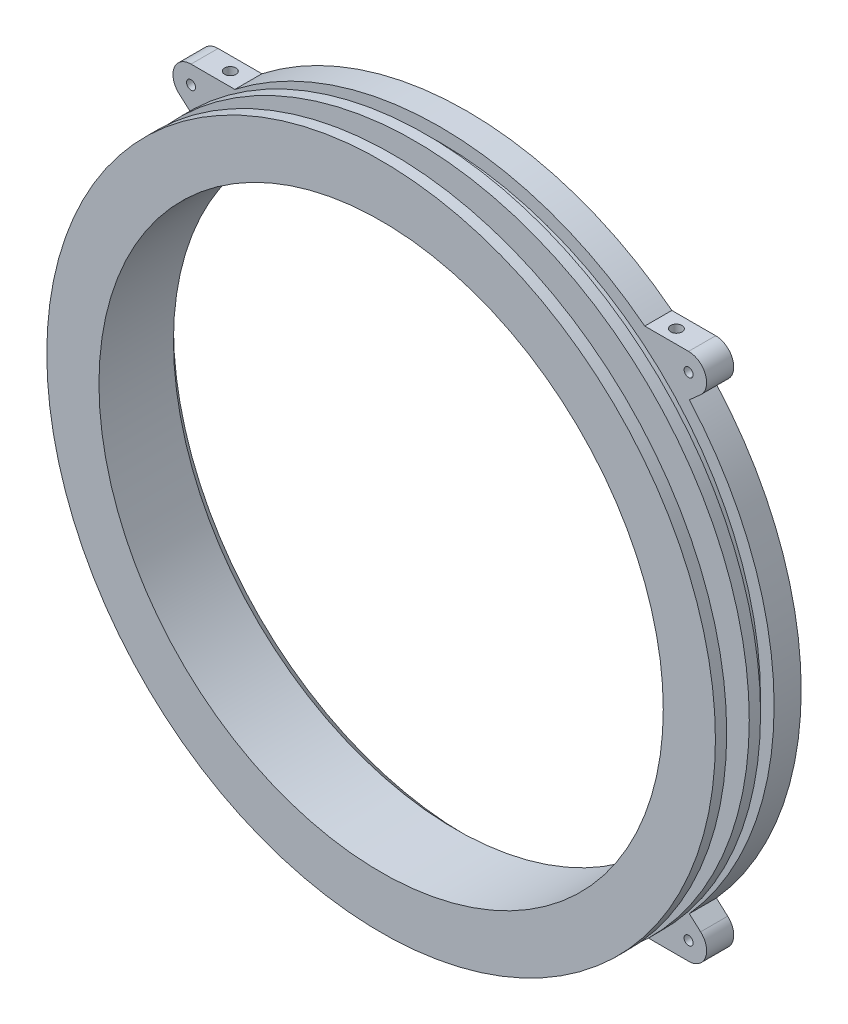
from build123d import *

# Parameters (mm, degrees)
SKETCH_1_R               = 148.1
SKETCH_1_R_2             = 125
EXTRUDE_1_DEPTH          = 12
SKETCH_2_R               = 142.1
SKETCH_2_R_2             = 125
EXTRUDE_2_DEPTH          = 6
SKETCH_3_R               = 148.1
SKETCH_3_R_2             = 125
EXTRUDE_3_DEPTH          = 5
SKETCH_4_R               = 133.1
SKETCH_4_R_2             = 125
EXTRUDE_4_DEPTH          = 10
SKETCH_5_R               = 148.1
SKETCH_5_R_2             = 125
EXTRUDE_5_DEPTH          = 5
SKETCH_6_R               = 2
EXTRUDE_6_DEPTH          = 12
SKETCH_7_R               = 2.5
CUT_EXTRUDE_1_DEPTH      = 15
MIRROR_2_COPY_1_SKETCH_R = 2.5
MIRROR_2_COPY_1_DEPTH    = 15
MIRROR_2_COPY_2_SKETCH_R = 2.5
MIRROR_2_COPY_2_DEPTH    = 15
CHAMFER_1_SIZE           = 5


with BuildPart() as part:
    # 草图1 → 凸台-拉伸1 (new body)
    with BuildSketch(Plane.XY):
        Circle(SKETCH_1_R)
        Circle(SKETCH_1_R_2, mode=Mode.SUBTRACT)
    extrude(amount=EXTRUDE_1_DEPTH)

    # 草图2 → 凸台-拉伸2 (add)
    with BuildSketch(Plane.XY.offset(12)):
        Circle(SKETCH_2_R)
        Circle(SKETCH_2_R_2, mode=Mode.SUBTRACT)
    extrude(amount=EXTRUDE_2_DEPTH)

    # 草图3 → 凸台-拉伸3 (add)
    with BuildSketch(Plane.XY.offset(18)):
        Circle(SKETCH_3_R)
        Circle(SKETCH_3_R_2, mode=Mode.SUBTRACT)
    extrude(amount=EXTRUDE_3_DEPTH)

    # 草图4 → 凸台-拉伸4 (add)
    with BuildSketch(Plane.XY.offset(23)):
        Circle(SKETCH_4_R)
        Circle(SKETCH_4_R_2, mode=Mode.SUBTRACT)
    extrude(amount=EXTRUDE_4_DEPTH)

    # 草图5 → 凸台-拉伸5 (add)
    with BuildSketch(Plane.XY.offset(33)):
        Circle(SKETCH_5_R)
        Circle(SKETCH_5_R_2, mode=Mode.SUBTRACT)
    extrude(amount=EXTRUDE_5_DEPTH)

    # 草图6 → 凸台-拉伸6 (add)
    # profile 1 of 4: a face of its own
    with BuildSketch(Plane.XY):
        with BuildLine():
            Line((-90.799834802, 117), (-110.208193805, 117))
            ThreePointArc((-110.208193805, 117), (-117.683675787, 111.849064607), (-115.532726589, 103.029292284))
            Line((-115.532726589, 103.029292284), (-110.532726589, 98.570413171))
            ThreePointArc((-110.532726589, 98.570413171), (-101.087152926, 108.235842092), (-90.799834802, 117))
        make_face()
        with Locations((-110.208193805, 109)):
            Circle(SKETCH_6_R, mode=Mode.SUBTRACT)
    # profile 2 of 4: a face of its own
    with BuildSketch(Plane.XY):
        with BuildLine():
            Line((115.532726589, 103.029292284), (110.532726589, 98.570413171))
            ThreePointArc((110.532726589, 98.570413171), (101.087152926, 108.235842092), (90.799834802, 117))
            Line((90.799834802, 117), (110.208193805, 117))
            ThreePointArc((110.208193805, 117), (117.683675787, 111.849064607), (115.532726589, 103.029292284))
        make_face()
        with Locations((110.208193805, 109)):
            Circle(SKETCH_6_R, mode=Mode.SUBTRACT)
    # profile 3 of 4: a face of its own
    with BuildSketch(Plane.XY):
        with BuildLine():
            Line((115.532726589, -103.029292284), (110.532726589, -98.570413171))
            ThreePointArc((110.532726589, -98.570413171), (101.087152926, -108.235842092), (90.799834802, -117))
            Line((90.799834802, -117), (110.208193805, -117))
            ThreePointArc((110.208193805, -117), (117.683675787, -111.849064607), (115.532726589, -103.029292284))
        make_face()
        with Locations((110.208193805, -109)):
            Circle(SKETCH_6_R, mode=Mode.SUBTRACT)
    # profile 4 of 4: a face of its own
    with BuildSketch(Plane.XY):
        with BuildLine():
            Line((-115.532726589, -103.029292284), (-110.532726589, -98.570413171))
            ThreePointArc((-110.532726589, -98.570413171), (-101.087152926, -108.235842092), (-90.799834802, -117))
            Line((-90.799834802, -117), (-110.208193805, -117))
            ThreePointArc((-110.208193805, -117), (-117.683675787, -111.849064607), (-115.532726589, -103.029292284))
        make_face()
        with Locations((-110.208193805, -109)):
            Circle(SKETCH_6_R, mode=Mode.SUBTRACT)
    extrude(amount=EXTRUDE_6_DEPTH)

    # 草图7 → 切除-拉伸1 (cut)
    with BuildSketch(Plane(origin=(0, 117, 0), x_dir=(1, 0, 0), z_dir=(0, 1, 0))):
        with Locations((-98.799834802, -6)):
            Circle(SKETCH_7_R)
    cut_extrude_1 = extrude(amount=-CUT_EXTRUDE_1_DEPTH, mode=Mode.SUBTRACT)

    # 镜向1: 切除-拉伸1 across plane
    add(cut_extrude_1.mirror(Plane(origin=(0, 0, 0), x_dir=(0, 0, 1), z_dir=(1, 0, 0))), mode=Mode.SUBTRACT)

    # 镜向2 copy 1 sketch → 镜向2 copy 1 (cut)
    with BuildSketch(Plane(origin=(0, -117, 0), x_dir=(-1, 0, 0), z_dir=(0, -1, 0))):
        with Locations((-98.799834802, -6)):
            Circle(MIRROR_2_COPY_1_SKETCH_R)
    extrude(amount=-MIRROR_2_COPY_1_DEPTH, mode=Mode.SUBTRACT)

    # 镜向2 copy 2 sketch → 镜向2 copy 2 (cut)
    with BuildSketch(Plane.XZ.offset(117)):
        with Locations((-98.799834802, 6)):
            Circle(MIRROR_2_COPY_2_SKETCH_R)
    extrude(amount=-MIRROR_2_COPY_2_DEPTH, mode=Mode.SUBTRACT)

    # 倒角1
    chamfer_1_edges = [part.edges().sort_by_distance(p)[0] for p in [
        (-125, 0, 0),
    ]]
    chamfer(chamfer_1_edges, length=CHAMFER_1_SIZE)


solid = part.part
